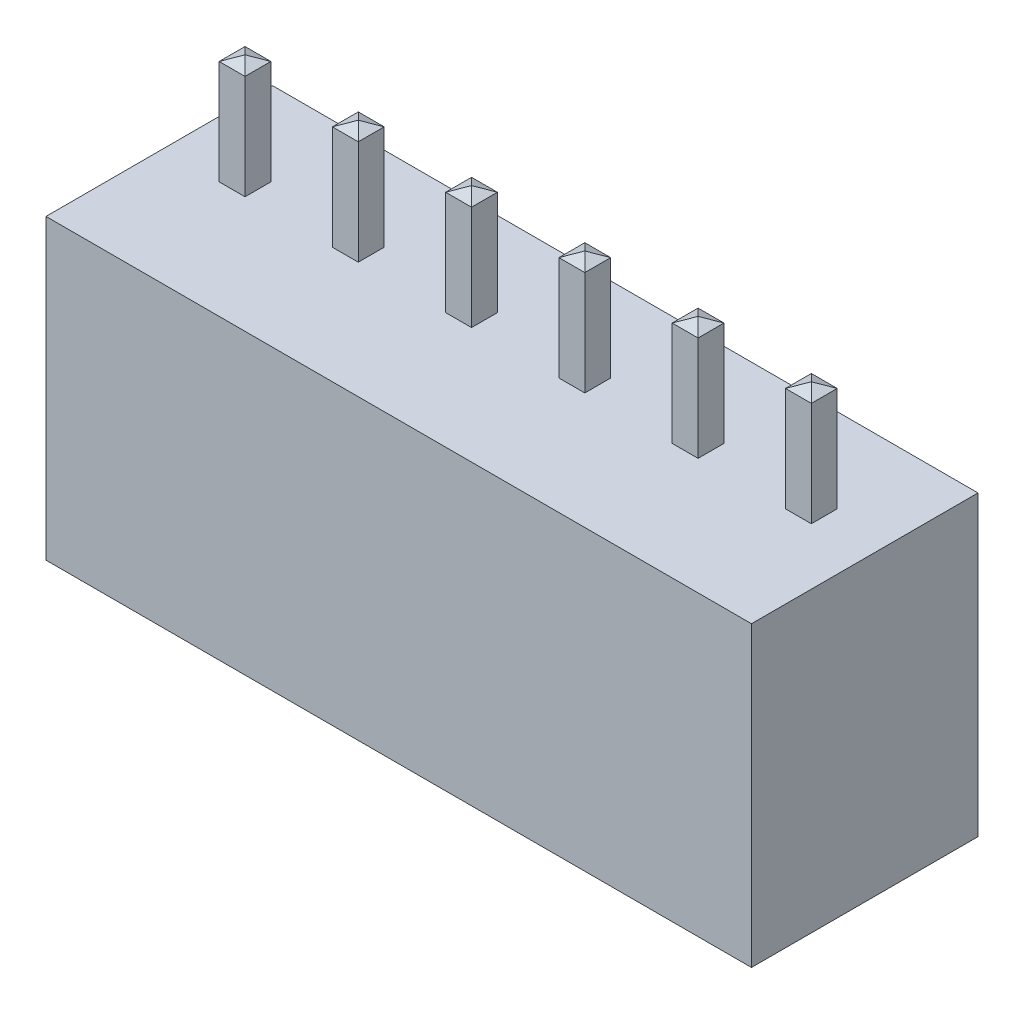
from build123d import *
from OCP.BRepFilletAPI import BRepFilletAPI_MakeChamfer

# Parameters (mm, degrees)
SKETCH_1_W                           = 21.8
SKETCH_1_H                           = 9.2
EXTRUDE_1_DEPTH                      = 7
SKETCH_2_W                           = 0.8
SKETCH_2_H                           = 0.8
EXTRUDE_2_DEPTH                      = 3.4
CHAMFER_1_SIZE                       = 0.178091474
CHAMFER_1_SIZE_2                     = 0.4
CUT_EXTRUDE_1_DEPTH                  = 7
PATTERN_LINEAR_1_COUNT               = 6
PATTERN_LINEAR_1_PITCH               = 3.5
CHAMFER_1_OF_PATTERN_LINEAR_1_SIZE   = 0.178091474
CHAMFER_1_OF_PATTERN_LINEAR_1_SIZE_2 = 0.4
PATTERN_LINEAR_2_COUNT               = 6
PATTERN_LINEAR_2_PITCH               = 3.5
SKETCH_4_W                           = 0.8
SKETCH_4_H                           = 0.8
EXTRUDE_3_DEPTH                      = 6
CHAMFER_2_SIZE                       = 0.4
CHAMFER_2_SIZE2                      = 0.178091474
PATTERN_LINEAR_3_COUNT               = 6
PATTERN_LINEAR_3_PITCH               = 3.5
CHAMFER_2_OF_PATTERN_LINEAR_3_SIZE   = 0.4
CHAMFER_2_OF_PATTERN_LINEAR_3_SIZE2  = 0.178091474


with BuildPart() as part:
    # Эскиз1 → Бобышка-Вытянуть1 (new body)
    with BuildSketch(Plane.XY):
        with Locations((0, 4.6)):
            Rectangle(SKETCH_1_W, SKETCH_1_H)
    extrude(amount=EXTRUDE_1_DEPTH)

    # Эскиз2 → Бобышка-Вытянуть2 (add)
    with BuildSketch(Plane(origin=(0, 9.2, 9.2), x_dir=(-1, 0, 0), z_dir=(0, -1, 0))):
        with Locations((-8.75, 6.2)):
            Rectangle(SKETCH_2_W, SKETCH_2_H)
    extrude_2 = extrude(amount=-EXTRUDE_2_DEPTH)

    # Фаска1
    chamfer_1_edges_1 = [part.edges().sort_by_distance(p)[0] for p in [
        (8.35, 12.6, 3),
    ]]
    chamfer_1_side_1 = [part.faces().sort_by_distance(p)[0] for p in [
        (8.35, 12.596438171, 3),
    ]]
    chamfer_1_edges_2 = [part.edges().sort_by_distance(p)[0] for p in [
        (8.75, 12.6, 3.4),
    ]]
    chamfer_1_side_2 = [part.faces().sort_by_distance(p)[0] for p in [
        (8.75, 12.596438171, 3.4),
    ]]
    chamfer_1_edges_3 = [part.edges().sort_by_distance(p)[0] for p in [
        (9.15, 12.6, 3),
    ]]
    chamfer_1_side_3 = [part.faces().sort_by_distance(p)[0] for p in [
        (9.15, 12.596438171, 3),
    ]]
    chamfer_1_edges_4 = [part.edges().sort_by_distance(p)[0] for p in [
        (8.75, 12.6, 2.6),
    ]]
    chamfer_1_side_4 = [part.faces().sort_by_distance(p)[0] for p in [
        (8.75, 12.596438171, 2.6),
    ]]
    chamfer_1 = BRepFilletAPI_MakeChamfer(part.part.solid().wrapped)
    for e in chamfer_1_edges_1:
        chamfer_1.Add(CHAMFER_1_SIZE - 0.0001, CHAMFER_1_SIZE_2 - 0.0001, e.wrapped, chamfer_1_side_1[0].wrapped)
    for e in chamfer_1_edges_2:
        chamfer_1.Add(CHAMFER_1_SIZE - 0.0001, CHAMFER_1_SIZE_2 - 0.0001, e.wrapped, chamfer_1_side_2[0].wrapped)
    for e in chamfer_1_edges_3:
        chamfer_1.Add(CHAMFER_1_SIZE - 0.0001, CHAMFER_1_SIZE_2 - 0.0001, e.wrapped, chamfer_1_side_3[0].wrapped)
    for e in chamfer_1_edges_4:
        chamfer_1.Add(CHAMFER_1_SIZE - 0.0001, CHAMFER_1_SIZE_2 - 0.0001, e.wrapped, chamfer_1_side_4[0].wrapped)
    add(Compound.cast(chamfer_1.Shape()), mode=Mode.REPLACE)  # a hair under: the kernel refuses the full size

    # Эскиз3 → Вырез-Вытянуть1 (cut)
    with BuildSketch(Plane.XZ):
        Polygon((7.15, 0.8), (10.25, 0.8), (10.25, 5), (9.25, 5), (10.25, 6.5), (7.15, 6.5), (8.15, 5), (7.15, 5), align=None)
    cut_extrude_1 = extrude(amount=-CUT_EXTRUDE_1_DEPTH, mode=Mode.SUBTRACT)

    # Линейный массив1: Бобышка-Вытянуть2 ×6
    with Locations(*[(-i * PATTERN_LINEAR_1_PITCH, 0, 0) for i in range(1, PATTERN_LINEAR_1_COUNT)]):
        add(extrude_2)

    # Фаска1 of Линейный массив1
    chamfer_1_of_pattern_linear_1_edges_1 = [part.edges().sort_by_distance(p)[0] for p in [
        (4.85, 12.6, 3),
    ]]
    chamfer_1_of_pattern_linear_1_side_1 = [part.faces().sort_by_distance(p)[0] for p in [
        (4.85, 12.596438171, 3),
    ]]
    chamfer_1_of_pattern_linear_1_edges_2 = [part.edges().sort_by_distance(p)[0] for p in [
        (5.25, 12.6, 3.4),
    ]]
    chamfer_1_of_pattern_linear_1_side_2 = [part.faces().sort_by_distance(p)[0] for p in [
        (5.25, 12.596438171, 3.4),
    ]]
    chamfer_1_of_pattern_linear_1_edges_3 = [part.edges().sort_by_distance(p)[0] for p in [
        (5.65, 12.6, 3),
    ]]
    chamfer_1_of_pattern_linear_1_side_3 = [part.faces().sort_by_distance(p)[0] for p in [
        (5.65, 12.596438171, 3),
    ]]
    chamfer_1_of_pattern_linear_1_edges_4 = [part.edges().sort_by_distance(p)[0] for p in [
        (5.25, 12.6, 2.6),
    ]]
    chamfer_1_of_pattern_linear_1_side_4 = [part.faces().sort_by_distance(p)[0] for p in [
        (5.25, 12.596438171, 2.6),
    ]]
    chamfer_1_of_pattern_linear_1_edges_5 = [part.edges().sort_by_distance(p)[0] for p in [
        (1.35, 12.6, 3),
    ]]
    chamfer_1_of_pattern_linear_1_side_5 = [part.faces().sort_by_distance(p)[0] for p in [
        (1.35, 12.596438171, 3),
    ]]
    chamfer_1_of_pattern_linear_1_edges_6 = [part.edges().sort_by_distance(p)[0] for p in [
        (1.75, 12.6, 3.4),
    ]]
    chamfer_1_of_pattern_linear_1_side_6 = [part.faces().sort_by_distance(p)[0] for p in [
        (1.75, 12.596438171, 3.4),
    ]]
    chamfer_1_of_pattern_linear_1_edges_7 = [part.edges().sort_by_distance(p)[0] for p in [
        (2.15, 12.6, 3),
    ]]
    chamfer_1_of_pattern_linear_1_side_7 = [part.faces().sort_by_distance(p)[0] for p in [
        (2.15, 12.596438171, 3),
    ]]
    chamfer_1_of_pattern_linear_1_edges_8 = [part.edges().sort_by_distance(p)[0] for p in [
        (1.75, 12.6, 2.6),
    ]]
    chamfer_1_of_pattern_linear_1_side_8 = [part.faces().sort_by_distance(p)[0] for p in [
        (1.75, 12.596438171, 2.6),
    ]]
    chamfer_1_of_pattern_linear_1_edges_9 = [part.edges().sort_by_distance(p)[0] for p in [
        (-2.15, 12.6, 3),
    ]]
    chamfer_1_of_pattern_linear_1_side_9 = [part.faces().sort_by_distance(p)[0] for p in [
        (-2.15, 12.596438171, 3),
    ]]
    chamfer_1_of_pattern_linear_1_edges_10 = [part.edges().sort_by_distance(p)[0] for p in [
        (-1.75, 12.6, 3.4),
    ]]
    chamfer_1_of_pattern_linear_1_side_10 = [part.faces().sort_by_distance(p)[0] for p in [
        (-1.75, 12.596438171, 3.4),
    ]]
    chamfer_1_of_pattern_linear_1_edges_11 = [part.edges().sort_by_distance(p)[0] for p in [
        (-1.35, 12.6, 3),
    ]]
    chamfer_1_of_pattern_linear_1_side_11 = [part.faces().sort_by_distance(p)[0] for p in [
        (-1.35, 12.596438171, 3),
    ]]
    chamfer_1_of_pattern_linear_1_edges_12 = [part.edges().sort_by_distance(p)[0] for p in [
        (-1.75, 12.6, 2.6),
    ]]
    chamfer_1_of_pattern_linear_1_side_12 = [part.faces().sort_by_distance(p)[0] for p in [
        (-1.75, 12.596438171, 2.6),
    ]]
    chamfer_1_of_pattern_linear_1_edges_13 = [part.edges().sort_by_distance(p)[0] for p in [
        (-5.65, 12.6, 3),
    ]]
    chamfer_1_of_pattern_linear_1_side_13 = [part.faces().sort_by_distance(p)[0] for p in [
        (-5.65, 12.596438171, 3),
    ]]
    chamfer_1_of_pattern_linear_1_edges_14 = [part.edges().sort_by_distance(p)[0] for p in [
        (-5.25, 12.6, 3.4),
    ]]
    chamfer_1_of_pattern_linear_1_side_14 = [part.faces().sort_by_distance(p)[0] for p in [
        (-5.25, 12.596438171, 3.4),
    ]]
    chamfer_1_of_pattern_linear_1_edges_15 = [part.edges().sort_by_distance(p)[0] for p in [
        (-4.85, 12.6, 3),
    ]]
    chamfer_1_of_pattern_linear_1_side_15 = [part.faces().sort_by_distance(p)[0] for p in [
        (-4.85, 12.596438171, 3),
    ]]
    chamfer_1_of_pattern_linear_1_edges_16 = [part.edges().sort_by_distance(p)[0] for p in [
        (-5.25, 12.6, 2.6),
    ]]
    chamfer_1_of_pattern_linear_1_side_16 = [part.faces().sort_by_distance(p)[0] for p in [
        (-5.25, 12.596438171, 2.6),
    ]]
    chamfer_1_of_pattern_linear_1_edges_17 = [part.edges().sort_by_distance(p)[0] for p in [
        (-9.15, 12.6, 3),
    ]]
    chamfer_1_of_pattern_linear_1_side_17 = [part.faces().sort_by_distance(p)[0] for p in [
        (-9.15, 12.596438171, 3),
    ]]
    chamfer_1_of_pattern_linear_1_edges_18 = [part.edges().sort_by_distance(p)[0] for p in [
        (-8.75, 12.6, 3.4),
    ]]
    chamfer_1_of_pattern_linear_1_side_18 = [part.faces().sort_by_distance(p)[0] for p in [
        (-8.75, 12.596438171, 3.4),
    ]]
    chamfer_1_of_pattern_linear_1_edges_19 = [part.edges().sort_by_distance(p)[0] for p in [
        (-8.35, 12.6, 3),
    ]]
    chamfer_1_of_pattern_linear_1_side_19 = [part.faces().sort_by_distance(p)[0] for p in [
        (-8.35, 12.596438171, 3),
    ]]
    chamfer_1_of_pattern_linear_1_edges_20 = [part.edges().sort_by_distance(p)[0] for p in [
        (-8.75, 12.6, 2.6),
    ]]
    chamfer_1_of_pattern_linear_1_side_20 = [part.faces().sort_by_distance(p)[0] for p in [
        (-8.75, 12.596438171, 2.6),
    ]]
    chamfer_1_of_pattern_linear_1 = BRepFilletAPI_MakeChamfer(part.part.solid().wrapped)
    for e in chamfer_1_of_pattern_linear_1_edges_1:
        chamfer_1_of_pattern_linear_1.Add(CHAMFER_1_OF_PATTERN_LINEAR_1_SIZE - 0.0001, CHAMFER_1_OF_PATTERN_LINEAR_1_SIZE_2 - 0.0001, e.wrapped, chamfer_1_of_pattern_linear_1_side_1[0].wrapped)
    for e in chamfer_1_of_pattern_linear_1_edges_2:
        chamfer_1_of_pattern_linear_1.Add(CHAMFER_1_OF_PATTERN_LINEAR_1_SIZE - 0.0001, CHAMFER_1_OF_PATTERN_LINEAR_1_SIZE_2 - 0.0001, e.wrapped, chamfer_1_of_pattern_linear_1_side_2[0].wrapped)
    for e in chamfer_1_of_pattern_linear_1_edges_3:
        chamfer_1_of_pattern_linear_1.Add(CHAMFER_1_OF_PATTERN_LINEAR_1_SIZE - 0.0001, CHAMFER_1_OF_PATTERN_LINEAR_1_SIZE_2 - 0.0001, e.wrapped, chamfer_1_of_pattern_linear_1_side_3[0].wrapped)
    for e in chamfer_1_of_pattern_linear_1_edges_4:
        chamfer_1_of_pattern_linear_1.Add(CHAMFER_1_OF_PATTERN_LINEAR_1_SIZE - 0.0001, CHAMFER_1_OF_PATTERN_LINEAR_1_SIZE_2 - 0.0001, e.wrapped, chamfer_1_of_pattern_linear_1_side_4[0].wrapped)
    for e in chamfer_1_of_pattern_linear_1_edges_5:
        chamfer_1_of_pattern_linear_1.Add(CHAMFER_1_OF_PATTERN_LINEAR_1_SIZE - 0.0001, CHAMFER_1_OF_PATTERN_LINEAR_1_SIZE_2 - 0.0001, e.wrapped, chamfer_1_of_pattern_linear_1_side_5[0].wrapped)
    for e in chamfer_1_of_pattern_linear_1_edges_6:
        chamfer_1_of_pattern_linear_1.Add(CHAMFER_1_OF_PATTERN_LINEAR_1_SIZE - 0.0001, CHAMFER_1_OF_PATTERN_LINEAR_1_SIZE_2 - 0.0001, e.wrapped, chamfer_1_of_pattern_linear_1_side_6[0].wrapped)
    for e in chamfer_1_of_pattern_linear_1_edges_7:
        chamfer_1_of_pattern_linear_1.Add(CHAMFER_1_OF_PATTERN_LINEAR_1_SIZE - 0.0001, CHAMFER_1_OF_PATTERN_LINEAR_1_SIZE_2 - 0.0001, e.wrapped, chamfer_1_of_pattern_linear_1_side_7[0].wrapped)
    for e in chamfer_1_of_pattern_linear_1_edges_8:
        chamfer_1_of_pattern_linear_1.Add(CHAMFER_1_OF_PATTERN_LINEAR_1_SIZE - 0.0001, CHAMFER_1_OF_PATTERN_LINEAR_1_SIZE_2 - 0.0001, e.wrapped, chamfer_1_of_pattern_linear_1_side_8[0].wrapped)
    for e in chamfer_1_of_pattern_linear_1_edges_9:
        chamfer_1_of_pattern_linear_1.Add(CHAMFER_1_OF_PATTERN_LINEAR_1_SIZE - 0.0001, CHAMFER_1_OF_PATTERN_LINEAR_1_SIZE_2 - 0.0001, e.wrapped, chamfer_1_of_pattern_linear_1_side_9[0].wrapped)
    for e in chamfer_1_of_pattern_linear_1_edges_10:
        chamfer_1_of_pattern_linear_1.Add(CHAMFER_1_OF_PATTERN_LINEAR_1_SIZE - 0.0001, CHAMFER_1_OF_PATTERN_LINEAR_1_SIZE_2 - 0.0001, e.wrapped, chamfer_1_of_pattern_linear_1_side_10[0].wrapped)
    for e in chamfer_1_of_pattern_linear_1_edges_11:
        chamfer_1_of_pattern_linear_1.Add(CHAMFER_1_OF_PATTERN_LINEAR_1_SIZE - 0.0001, CHAMFER_1_OF_PATTERN_LINEAR_1_SIZE_2 - 0.0001, e.wrapped, chamfer_1_of_pattern_linear_1_side_11[0].wrapped)
    for e in chamfer_1_of_pattern_linear_1_edges_12:
        chamfer_1_of_pattern_linear_1.Add(CHAMFER_1_OF_PATTERN_LINEAR_1_SIZE - 0.0001, CHAMFER_1_OF_PATTERN_LINEAR_1_SIZE_2 - 0.0001, e.wrapped, chamfer_1_of_pattern_linear_1_side_12[0].wrapped)
    for e in chamfer_1_of_pattern_linear_1_edges_13:
        chamfer_1_of_pattern_linear_1.Add(CHAMFER_1_OF_PATTERN_LINEAR_1_SIZE - 0.0001, CHAMFER_1_OF_PATTERN_LINEAR_1_SIZE_2 - 0.0001, e.wrapped, chamfer_1_of_pattern_linear_1_side_13[0].wrapped)
    for e in chamfer_1_of_pattern_linear_1_edges_14:
        chamfer_1_of_pattern_linear_1.Add(CHAMFER_1_OF_PATTERN_LINEAR_1_SIZE - 0.0001, CHAMFER_1_OF_PATTERN_LINEAR_1_SIZE_2 - 0.0001, e.wrapped, chamfer_1_of_pattern_linear_1_side_14[0].wrapped)
    for e in chamfer_1_of_pattern_linear_1_edges_15:
        chamfer_1_of_pattern_linear_1.Add(CHAMFER_1_OF_PATTERN_LINEAR_1_SIZE - 0.0001, CHAMFER_1_OF_PATTERN_LINEAR_1_SIZE_2 - 0.0001, e.wrapped, chamfer_1_of_pattern_linear_1_side_15[0].wrapped)
    for e in chamfer_1_of_pattern_linear_1_edges_16:
        chamfer_1_of_pattern_linear_1.Add(CHAMFER_1_OF_PATTERN_LINEAR_1_SIZE - 0.0001, CHAMFER_1_OF_PATTERN_LINEAR_1_SIZE_2 - 0.0001, e.wrapped, chamfer_1_of_pattern_linear_1_side_16[0].wrapped)
    for e in chamfer_1_of_pattern_linear_1_edges_17:
        chamfer_1_of_pattern_linear_1.Add(CHAMFER_1_OF_PATTERN_LINEAR_1_SIZE - 0.0001, CHAMFER_1_OF_PATTERN_LINEAR_1_SIZE_2 - 0.0001, e.wrapped, chamfer_1_of_pattern_linear_1_side_17[0].wrapped)
    for e in chamfer_1_of_pattern_linear_1_edges_18:
        chamfer_1_of_pattern_linear_1.Add(CHAMFER_1_OF_PATTERN_LINEAR_1_SIZE - 0.0001, CHAMFER_1_OF_PATTERN_LINEAR_1_SIZE_2 - 0.0001, e.wrapped, chamfer_1_of_pattern_linear_1_side_18[0].wrapped)
    for e in chamfer_1_of_pattern_linear_1_edges_19:
        chamfer_1_of_pattern_linear_1.Add(CHAMFER_1_OF_PATTERN_LINEAR_1_SIZE - 0.0001, CHAMFER_1_OF_PATTERN_LINEAR_1_SIZE_2 - 0.0001, e.wrapped, chamfer_1_of_pattern_linear_1_side_19[0].wrapped)
    for e in chamfer_1_of_pattern_linear_1_edges_20:
        chamfer_1_of_pattern_linear_1.Add(CHAMFER_1_OF_PATTERN_LINEAR_1_SIZE - 0.0001, CHAMFER_1_OF_PATTERN_LINEAR_1_SIZE_2 - 0.0001, e.wrapped, chamfer_1_of_pattern_linear_1_side_20[0].wrapped)
    add(Compound.cast(chamfer_1_of_pattern_linear_1.Shape()), mode=Mode.REPLACE)  # a hair under: the kernel refuses the full size

    # Линейный массив2: Вырез-Вытянуть1 ×6
    with Locations(*[(-i * PATTERN_LINEAR_2_PITCH, 0, 0) for i in range(1, PATTERN_LINEAR_2_COUNT)]):
        add(cut_extrude_1, mode=Mode.SUBTRACT)

    # Эскиз4 → Бобышка-Вытянуть3 (add)
    with BuildSketch(Plane.XZ.offset(-7)):
        with Locations((8.75, 3)):
            Rectangle(SKETCH_4_W, SKETCH_4_H)
    extrude_3 = extrude(amount=EXTRUDE_3_DEPTH)

    # Фаска2: one chamfer whose edges measure the first distance from different faces: ONE call of the kernel's chamfer builder (chamfer() names one face for all edges)
    chamfer_2_edges_1 = [part.edges().sort_by_distance(p)[0] for p in [
        (9.15, 1, 3),
    ]]
    chamfer_2_side_1 = [part.faces().sort_by_distance(p)[0] for p in [
        (9.15, 4, 3),
    ]]
    chamfer_2_edges_2 = [part.edges().sort_by_distance(p)[0] for p in [
        (8.75, 1, 3.4),
    ]]
    chamfer_2_side_2 = [part.faces().sort_by_distance(p)[0] for p in [
        (8.75, 4, 3.4),
    ]]
    chamfer_2_edges_3 = [part.edges().sort_by_distance(p)[0] for p in [
        (8.35, 1, 3),
    ]]
    chamfer_2_side_3 = [part.faces().sort_by_distance(p)[0] for p in [
        (8.35, 4, 3),
    ]]
    chamfer_2_edges_4 = [part.edges().sort_by_distance(p)[0] for p in [
        (8.75, 1, 2.6),
    ]]
    chamfer_2_side_4 = [part.faces().sort_by_distance(p)[0] for p in [
        (8.75, 4, 2.6),
    ]]
    chamfer_2 = BRepFilletAPI_MakeChamfer(part.part.solid().wrapped)
    for e in chamfer_2_edges_1:
        chamfer_2.Add(CHAMFER_2_SIZE, CHAMFER_2_SIZE2, e.wrapped, chamfer_2_side_1[0].wrapped)  # the first distance lies on this face
    for e in chamfer_2_edges_2:
        chamfer_2.Add(CHAMFER_2_SIZE, CHAMFER_2_SIZE2, e.wrapped, chamfer_2_side_2[0].wrapped)  # the first distance lies on this face
    for e in chamfer_2_edges_3:
        chamfer_2.Add(CHAMFER_2_SIZE, CHAMFER_2_SIZE2, e.wrapped, chamfer_2_side_3[0].wrapped)  # the first distance lies on this face
    for e in chamfer_2_edges_4:
        chamfer_2.Add(CHAMFER_2_SIZE, CHAMFER_2_SIZE2, e.wrapped, chamfer_2_side_4[0].wrapped)  # the first distance lies on this face
    add(Compound.cast(chamfer_2.Shape()), mode=Mode.REPLACE)

    # Линейный массив3: Бобышка-Вытянуть3 ×6
    with Locations(*[(-i * PATTERN_LINEAR_3_PITCH, 0, 0) for i in range(1, PATTERN_LINEAR_3_COUNT)]):
        add(extrude_3)

    # Фаска2 of Линейный массив3: one chamfer whose edges measure the first distance from different faces: ONE call of the kernel's chamfer builder (chamfer() names one face for all edges)
    chamfer_2_of_pattern_linear_3_edges_1 = [part.edges().sort_by_distance(p)[0] for p in [
        (5.65, 1, 3),
    ]]
    chamfer_2_of_pattern_linear_3_side_1 = [part.faces().sort_by_distance(p)[0] for p in [
        (5.65, 4, 3),
    ]]
    chamfer_2_of_pattern_linear_3_edges_2 = [part.edges().sort_by_distance(p)[0] for p in [
        (5.25, 1, 3.4),
    ]]
    chamfer_2_of_pattern_linear_3_side_2 = [part.faces().sort_by_distance(p)[0] for p in [
        (5.25, 4, 3.4),
    ]]
    chamfer_2_of_pattern_linear_3_edges_3 = [part.edges().sort_by_distance(p)[0] for p in [
        (4.85, 1, 3),
    ]]
    chamfer_2_of_pattern_linear_3_side_3 = [part.faces().sort_by_distance(p)[0] for p in [
        (4.85, 4, 3),
    ]]
    chamfer_2_of_pattern_linear_3_edges_4 = [part.edges().sort_by_distance(p)[0] for p in [
        (5.25, 1, 2.6),
    ]]
    chamfer_2_of_pattern_linear_3_side_4 = [part.faces().sort_by_distance(p)[0] for p in [
        (5.25, 4, 2.6),
    ]]
    chamfer_2_of_pattern_linear_3_edges_5 = [part.edges().sort_by_distance(p)[0] for p in [
        (2.15, 1, 3),
    ]]
    chamfer_2_of_pattern_linear_3_side_5 = [part.faces().sort_by_distance(p)[0] for p in [
        (2.15, 4, 3),
    ]]
    chamfer_2_of_pattern_linear_3_edges_6 = [part.edges().sort_by_distance(p)[0] for p in [
        (1.75, 1, 3.4),
    ]]
    chamfer_2_of_pattern_linear_3_side_6 = [part.faces().sort_by_distance(p)[0] for p in [
        (1.75, 4, 3.4),
    ]]
    chamfer_2_of_pattern_linear_3_edges_7 = [part.edges().sort_by_distance(p)[0] for p in [
        (1.35, 1, 3),
    ]]
    chamfer_2_of_pattern_linear_3_side_7 = [part.faces().sort_by_distance(p)[0] for p in [
        (1.35, 4, 3),
    ]]
    chamfer_2_of_pattern_linear_3_edges_8 = [part.edges().sort_by_distance(p)[0] for p in [
        (1.75, 1, 2.6),
    ]]
    chamfer_2_of_pattern_linear_3_side_8 = [part.faces().sort_by_distance(p)[0] for p in [
        (1.75, 4, 2.6),
    ]]
    chamfer_2_of_pattern_linear_3_edges_9 = [part.edges().sort_by_distance(p)[0] for p in [
        (-1.35, 1, 3),
    ]]
    chamfer_2_of_pattern_linear_3_side_9 = [part.faces().sort_by_distance(p)[0] for p in [
        (-1.35, 4, 3),
    ]]
    chamfer_2_of_pattern_linear_3_edges_10 = [part.edges().sort_by_distance(p)[0] for p in [
        (-1.75, 1, 3.4),
    ]]
    chamfer_2_of_pattern_linear_3_side_10 = [part.faces().sort_by_distance(p)[0] for p in [
        (-1.75, 4, 3.4),
    ]]
    chamfer_2_of_pattern_linear_3_edges_11 = [part.edges().sort_by_distance(p)[0] for p in [
        (-2.15, 1, 3),
    ]]
    chamfer_2_of_pattern_linear_3_side_11 = [part.faces().sort_by_distance(p)[0] for p in [
        (-2.15, 4, 3),
    ]]
    chamfer_2_of_pattern_linear_3_edges_12 = [part.edges().sort_by_distance(p)[0] for p in [
        (-1.75, 1, 2.6),
    ]]
    chamfer_2_of_pattern_linear_3_side_12 = [part.faces().sort_by_distance(p)[0] for p in [
        (-1.75, 4, 2.6),
    ]]
    chamfer_2_of_pattern_linear_3_edges_13 = [part.edges().sort_by_distance(p)[0] for p in [
        (-4.85, 1, 3),
    ]]
    chamfer_2_of_pattern_linear_3_side_13 = [part.faces().sort_by_distance(p)[0] for p in [
        (-4.85, 4, 3),
    ]]
    chamfer_2_of_pattern_linear_3_edges_14 = [part.edges().sort_by_distance(p)[0] for p in [
        (-5.25, 1, 3.4),
    ]]
    chamfer_2_of_pattern_linear_3_side_14 = [part.faces().sort_by_distance(p)[0] for p in [
        (-5.25, 4, 3.4),
    ]]
    chamfer_2_of_pattern_linear_3_edges_15 = [part.edges().sort_by_distance(p)[0] for p in [
        (-5.65, 1, 3),
    ]]
    chamfer_2_of_pattern_linear_3_side_15 = [part.faces().sort_by_distance(p)[0] for p in [
        (-5.65, 4, 3),
    ]]
    chamfer_2_of_pattern_linear_3_edges_16 = [part.edges().sort_by_distance(p)[0] for p in [
        (-5.25, 1, 2.6),
    ]]
    chamfer_2_of_pattern_linear_3_side_16 = [part.faces().sort_by_distance(p)[0] for p in [
        (-5.25, 4, 2.6),
    ]]
    chamfer_2_of_pattern_linear_3_edges_17 = [part.edges().sort_by_distance(p)[0] for p in [
        (-8.35, 1, 3),
    ]]
    chamfer_2_of_pattern_linear_3_side_17 = [part.faces().sort_by_distance(p)[0] for p in [
        (-8.35, 4, 3),
    ]]
    chamfer_2_of_pattern_linear_3_edges_18 = [part.edges().sort_by_distance(p)[0] for p in [
        (-8.75, 1, 3.4),
    ]]
    chamfer_2_of_pattern_linear_3_side_18 = [part.faces().sort_by_distance(p)[0] for p in [
        (-8.75, 4, 3.4),
    ]]
    chamfer_2_of_pattern_linear_3_edges_19 = [part.edges().sort_by_distance(p)[0] for p in [
        (-9.15, 1, 3),
    ]]
    chamfer_2_of_pattern_linear_3_side_19 = [part.faces().sort_by_distance(p)[0] for p in [
        (-9.15, 4, 3),
    ]]
    chamfer_2_of_pattern_linear_3_edges_20 = [part.edges().sort_by_distance(p)[0] for p in [
        (-8.75, 1, 2.6),
    ]]
    chamfer_2_of_pattern_linear_3_side_20 = [part.faces().sort_by_distance(p)[0] for p in [
        (-8.75, 4, 2.6),
    ]]
    chamfer_2_of_pattern_linear_3 = BRepFilletAPI_MakeChamfer(part.part.solid().wrapped)
    for e in chamfer_2_of_pattern_linear_3_edges_1:
        chamfer_2_of_pattern_linear_3.Add(CHAMFER_2_OF_PATTERN_LINEAR_3_SIZE, CHAMFER_2_OF_PATTERN_LINEAR_3_SIZE2, e.wrapped, chamfer_2_of_pattern_linear_3_side_1[0].wrapped)  # the first distance lies on this face
    for e in chamfer_2_of_pattern_linear_3_edges_2:
        chamfer_2_of_pattern_linear_3.Add(CHAMFER_2_OF_PATTERN_LINEAR_3_SIZE, CHAMFER_2_OF_PATTERN_LINEAR_3_SIZE2, e.wrapped, chamfer_2_of_pattern_linear_3_side_2[0].wrapped)  # the first distance lies on this face
    for e in chamfer_2_of_pattern_linear_3_edges_3:
        chamfer_2_of_pattern_linear_3.Add(CHAMFER_2_OF_PATTERN_LINEAR_3_SIZE, CHAMFER_2_OF_PATTERN_LINEAR_3_SIZE2, e.wrapped, chamfer_2_of_pattern_linear_3_side_3[0].wrapped)  # the first distance lies on this face
    for e in chamfer_2_of_pattern_linear_3_edges_4:
        chamfer_2_of_pattern_linear_3.Add(CHAMFER_2_OF_PATTERN_LINEAR_3_SIZE, CHAMFER_2_OF_PATTERN_LINEAR_3_SIZE2, e.wrapped, chamfer_2_of_pattern_linear_3_side_4[0].wrapped)  # the first distance lies on this face
    for e in chamfer_2_of_pattern_linear_3_edges_5:
        chamfer_2_of_pattern_linear_3.Add(CHAMFER_2_OF_PATTERN_LINEAR_3_SIZE, CHAMFER_2_OF_PATTERN_LINEAR_3_SIZE2, e.wrapped, chamfer_2_of_pattern_linear_3_side_5[0].wrapped)  # the first distance lies on this face
    for e in chamfer_2_of_pattern_linear_3_edges_6:
        chamfer_2_of_pattern_linear_3.Add(CHAMFER_2_OF_PATTERN_LINEAR_3_SIZE, CHAMFER_2_OF_PATTERN_LINEAR_3_SIZE2, e.wrapped, chamfer_2_of_pattern_linear_3_side_6[0].wrapped)  # the first distance lies on this face
    for e in chamfer_2_of_pattern_linear_3_edges_7:
        chamfer_2_of_pattern_linear_3.Add(CHAMFER_2_OF_PATTERN_LINEAR_3_SIZE, CHAMFER_2_OF_PATTERN_LINEAR_3_SIZE2, e.wrapped, chamfer_2_of_pattern_linear_3_side_7[0].wrapped)  # the first distance lies on this face
    for e in chamfer_2_of_pattern_linear_3_edges_8:
        chamfer_2_of_pattern_linear_3.Add(CHAMFER_2_OF_PATTERN_LINEAR_3_SIZE, CHAMFER_2_OF_PATTERN_LINEAR_3_SIZE2, e.wrapped, chamfer_2_of_pattern_linear_3_side_8[0].wrapped)  # the first distance lies on this face
    for e in chamfer_2_of_pattern_linear_3_edges_9:
        chamfer_2_of_pattern_linear_3.Add(CHAMFER_2_OF_PATTERN_LINEAR_3_SIZE, CHAMFER_2_OF_PATTERN_LINEAR_3_SIZE2, e.wrapped, chamfer_2_of_pattern_linear_3_side_9[0].wrapped)  # the first distance lies on this face
    for e in chamfer_2_of_pattern_linear_3_edges_10:
        chamfer_2_of_pattern_linear_3.Add(CHAMFER_2_OF_PATTERN_LINEAR_3_SIZE, CHAMFER_2_OF_PATTERN_LINEAR_3_SIZE2, e.wrapped, chamfer_2_of_pattern_linear_3_side_10[0].wrapped)  # the first distance lies on this face
    for e in chamfer_2_of_pattern_linear_3_edges_11:
        chamfer_2_of_pattern_linear_3.Add(CHAMFER_2_OF_PATTERN_LINEAR_3_SIZE, CHAMFER_2_OF_PATTERN_LINEAR_3_SIZE2, e.wrapped, chamfer_2_of_pattern_linear_3_side_11[0].wrapped)  # the first distance lies on this face
    for e in chamfer_2_of_pattern_linear_3_edges_12:
        chamfer_2_of_pattern_linear_3.Add(CHAMFER_2_OF_PATTERN_LINEAR_3_SIZE, CHAMFER_2_OF_PATTERN_LINEAR_3_SIZE2, e.wrapped, chamfer_2_of_pattern_linear_3_side_12[0].wrapped)  # the first distance lies on this face
    for e in chamfer_2_of_pattern_linear_3_edges_13:
        chamfer_2_of_pattern_linear_3.Add(CHAMFER_2_OF_PATTERN_LINEAR_3_SIZE, CHAMFER_2_OF_PATTERN_LINEAR_3_SIZE2, e.wrapped, chamfer_2_of_pattern_linear_3_side_13[0].wrapped)  # the first distance lies on this face
    for e in chamfer_2_of_pattern_linear_3_edges_14:
        chamfer_2_of_pattern_linear_3.Add(CHAMFER_2_OF_PATTERN_LINEAR_3_SIZE, CHAMFER_2_OF_PATTERN_LINEAR_3_SIZE2, e.wrapped, chamfer_2_of_pattern_linear_3_side_14[0].wrapped)  # the first distance lies on this face
    for e in chamfer_2_of_pattern_linear_3_edges_15:
        chamfer_2_of_pattern_linear_3.Add(CHAMFER_2_OF_PATTERN_LINEAR_3_SIZE, CHAMFER_2_OF_PATTERN_LINEAR_3_SIZE2, e.wrapped, chamfer_2_of_pattern_linear_3_side_15[0].wrapped)  # the first distance lies on this face
    for e in chamfer_2_of_pattern_linear_3_edges_16:
        chamfer_2_of_pattern_linear_3.Add(CHAMFER_2_OF_PATTERN_LINEAR_3_SIZE, CHAMFER_2_OF_PATTERN_LINEAR_3_SIZE2, e.wrapped, chamfer_2_of_pattern_linear_3_side_16[0].wrapped)  # the first distance lies on this face
    for e in chamfer_2_of_pattern_linear_3_edges_17:
        chamfer_2_of_pattern_linear_3.Add(CHAMFER_2_OF_PATTERN_LINEAR_3_SIZE, CHAMFER_2_OF_PATTERN_LINEAR_3_SIZE2, e.wrapped, chamfer_2_of_pattern_linear_3_side_17[0].wrapped)  # the first distance lies on this face
    for e in chamfer_2_of_pattern_linear_3_edges_18:
        chamfer_2_of_pattern_linear_3.Add(CHAMFER_2_OF_PATTERN_LINEAR_3_SIZE, CHAMFER_2_OF_PATTERN_LINEAR_3_SIZE2, e.wrapped, chamfer_2_of_pattern_linear_3_side_18[0].wrapped)  # the first distance lies on this face
    for e in chamfer_2_of_pattern_linear_3_edges_19:
        chamfer_2_of_pattern_linear_3.Add(CHAMFER_2_OF_PATTERN_LINEAR_3_SIZE, CHAMFER_2_OF_PATTERN_LINEAR_3_SIZE2, e.wrapped, chamfer_2_of_pattern_linear_3_side_19[0].wrapped)  # the first distance lies on this face
    for e in chamfer_2_of_pattern_linear_3_edges_20:
        chamfer_2_of_pattern_linear_3.Add(CHAMFER_2_OF_PATTERN_LINEAR_3_SIZE, CHAMFER_2_OF_PATTERN_LINEAR_3_SIZE2, e.wrapped, chamfer_2_of_pattern_linear_3_side_20[0].wrapped)  # the first distance lies on this face
    add(Compound.cast(chamfer_2_of_pattern_linear_3.Shape()), mode=Mode.REPLACE)


solid = part.part
